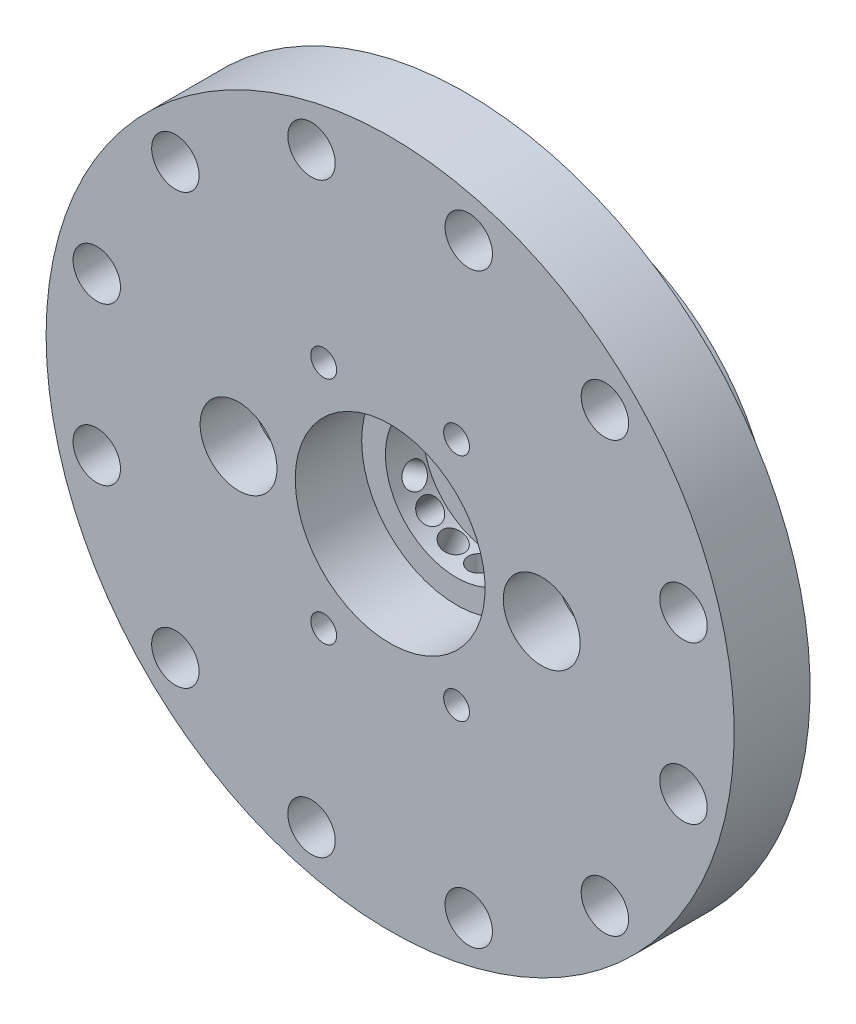
from build123d import *

# Parameters (mm, degrees)
FUEL_HOLE_R                  = 1.5875
FUEL_CHANNEL_DEPTH           = 68.167573371
FUEL_CHANNEL_PATTERN_COUNT   = 16
F_1_8_NPT_HOLES_OUTLINE_R    = 4.927336722
F_1_8_NPT_HOLES_DEPTH        = 6.92404
F_1_8_NPT_HOLES_DRAFT        = -1.78815
F_1_8_NPT_HOLES_2_OUTLINE_R  = 4.927336722
F_1_8_NPT_HOLES_2_DEPTH      = 6.92404
F_1_8_NPT_HOLES_2_DRAFT      = -1.78815
F_1_8_0_125_DIAMETER_HOLE1_D = 3.175
F_8_32_TAPPED_HOLE1_D        = 3.4544
F_8_32_TAPPED_HOLE1_DEPTH    = 7.62
F_8_32_TAPPED_HOLE1_TIP      = 1.037806461
F_1_4_0_25_DIAMETER_HOLE1_D  = 6.35
CIRPATTERN2_COUNT            = 12


# Read off the part's stored shape, not the designer's step: 1/8" NPT Holes
with BuildPart() as part:
    # Retainer Revolve → Primary Revolve (revolve)
    with BuildSketch(Plane(origin=(0, 0, 0), x_dir=(0, 0, -1), z_dir=(1, 0, 0)), mode=Mode.PRIVATE) as primary_revolve_sk:
        Polygon((0, 20.697087), (7.077813, 27.7749), (3.6068, 27.7749), (3.6068, 25.7175), (0, 25.7175), (0, 27.7749), (-2.54, 27.7749), (-2.54, 23.237087), (-6.35, 23.237087), (-6.35, 28.317087), (-6.35, 46.0375), (-16.51, 46.0375), (-16.51, 12.7), (-7.62, 12.7), (-7.62, 9.525), (-2.54, 9.525), (-2.54, 6.763580809), (0, 6.763580809), align=None)
    revolve(primary_revolve_sk.sketch.rotate(Axis((0, 0, -104.79165215), (0, 0, 1)), 90), axis=Axis((0, 0, -104.79165215), (0, 0, 1)))

    # Fuel Hole → Fuel Channel (cut, through all)
    with BuildSketch(Plane(origin=(0, 0, 0), x_dir=(1, 0, 0), z_dir=(0, 1, 0))):
        with Locations(Location((0, -4.445, 0), (0, 0, 90))):
            Circle(FUEL_HOLE_R)
    fuel_channel = extrude(amount=FUEL_CHANNEL_DEPTH, mode=Mode.SUBTRACT)

    # Fuel Channel Pattern: Fuel Channel ×16 about axis, 2 skipped
    fuel_channel_pattern_axis = Axis((0, 0, -104.79165215), (0, 0, 1))
    add([fuel_channel.rotate(fuel_channel_pattern_axis, i * 360 / FUEL_CHANNEL_PATTERN_COUNT) for i in range(1, FUEL_CHANNEL_PATTERN_COUNT) if i not in (4, 12)], mode=Mode.SUBTRACT)


with BuildPart() as f_1_8_npt_holes_tool:
    # 1/8" NPT Holes outline → 1/8" NPT Holes (with draft: the straight prism first)
    with BuildSketch(Plane.XY.offset(9.58596)):
        with Locations((20.284337, 0)):
            Circle(F_1_8_NPT_HOLES_OUTLINE_R)
    extrude(amount=F_1_8_NPT_HOLES_DEPTH)
    # 1/8" NPT Holes: the draft: its side faces are tilted about the plane it starts from
    f_1_8_npt_holes_sides = [f_1_8_npt_holes_tool.faces().sort_by_distance(p)[0] for p in [
        (15.357000278, 0, 13.04798),
    ]]
    draft(f_1_8_npt_holes_sides, Plane.XY.offset(9.58596), F_1_8_NPT_HOLES_DRAFT)


with BuildPart() as part_1:
    add(part.part)

    # 1/8" NPT Holes: cut by f_1_8_npt_holes_tool
    add(f_1_8_npt_holes_tool.part, mode=Mode.SUBTRACT)


with BuildPart() as f_1_8_npt_holes_2_tool:
    # 1_8_ NPT Holes 2 outline → 1_8_ NPT Holes 2 (with draft: the straight prism first)
    with BuildSketch(Plane.XY.offset(9.58596)):
        with Locations((-20.284337, 0)):
            Circle(F_1_8_NPT_HOLES_2_OUTLINE_R)
    extrude(amount=F_1_8_NPT_HOLES_2_DEPTH)
    # 1_8_ NPT Holes 2: the draft: its side faces are tilted about the plane it starts from
    f_1_8_npt_holes_2_sides = [f_1_8_npt_holes_2_tool.faces().sort_by_distance(p)[0] for p in [
        (-25.211673722, 0, 13.04798),
    ]]
    draft(f_1_8_npt_holes_2_sides, Plane.XY.offset(9.58596), F_1_8_NPT_HOLES_2_DRAFT)


with BuildPart() as part_2:
    add(part_1.part)

    # 1_8_ NPT Holes 2: cut by f_1_8_npt_holes_2_tool
    add(f_1_8_npt_holes_2_tool.part, mode=Mode.SUBTRACT)

    # 1/8 (0.125) Diameter Hole1 (through all)
    with Locations(Plane.XY.offset(16.51)):
        with Locations((-19.109587, 0), (19.109587, 0)):
            Hole(F_1_8_0_125_DIAMETER_HOLE1_D / 2)

    # #8-32 Tapped Hole1
    with Locations(Plane.XY.offset(16.51)):
        with Locations((-8.89, 15.397931679), (8.89, 15.397931679), (8.89, -15.397931679), (-8.89, -15.397931679)):
            Hole(F_8_32_TAPPED_HOLE1_D / 2, depth=F_8_32_TAPPED_HOLE1_DEPTH)
            with Locations((0, 0, -(F_8_32_TAPPED_HOLE1_DEPTH + F_8_32_TAPPED_HOLE1_TIP / 2))):  # 118° drill point
                Cone(0, F_8_32_TAPPED_HOLE1_D / 2, F_8_32_TAPPED_HOLE1_TIP, mode=Mode.SUBTRACT)

    # 1/4 (0.25) Diameter Hole1 (through all)
    with Locations(Plane(origin=(0, 0, 6.35), x_dir=(-1, 0, 0), z_dir=(0, 0, -1))):
        with Locations((-28.736819587, 28.736819587)):
            f_1_4_0_25_diameter_hole1 = Hole(F_1_4_0_25_DIAMETER_HOLE1_D / 2)

    # CirPattern2: 1/4 (0.25) Diameter Hole1 ×12 about axis
    cirpattern2_axis = Axis((0, 0, 0), (0, 0, 1))
    for i in range(1, CIRPATTERN2_COUNT):
        add(f_1_4_0_25_diameter_hole1.rotate(cirpattern2_axis, i * 360 / CIRPATTERN2_COUNT), mode=Mode.SUBTRACT)


solid = part_2.part
